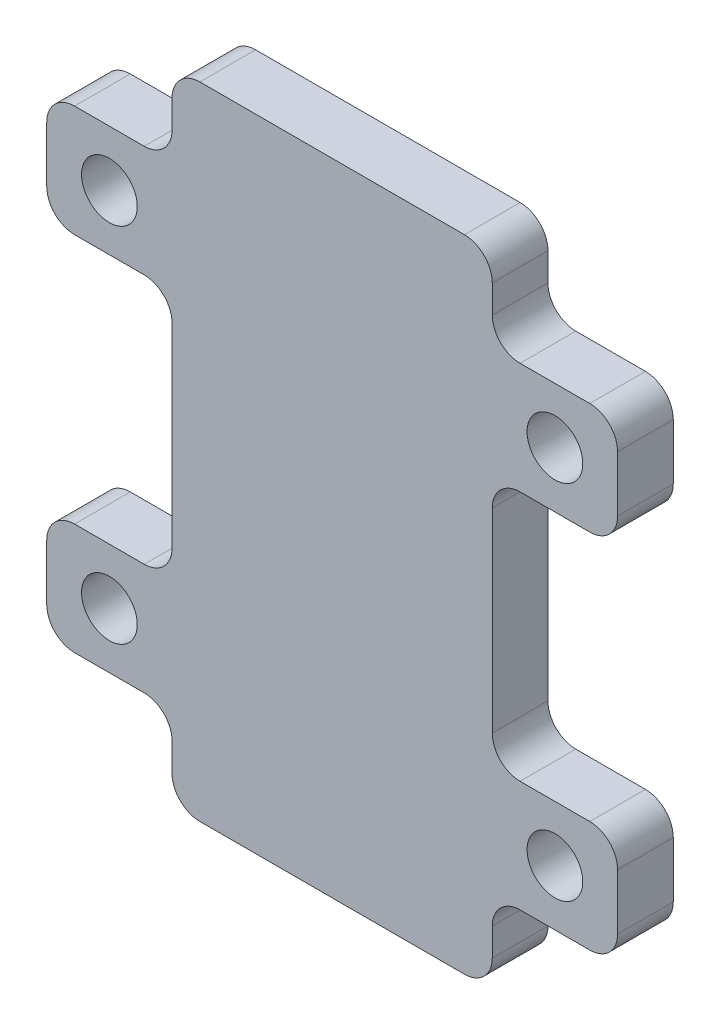
from build123d import *

# Parameters (mm, degrees)
SKETCH1_R           = 0.5
BOSS_EXTRUDE1_DEPTH = 1


with BuildPart() as part:
    # Sketch1 → Boss-Extrude1 (new body)
    with BuildSketch(Plane.XY):
        with BuildLine():
            Line((-2.875, 11), (-2.875, 10.5))
            ThreePointArc((-2.875, 10.5), (-3.021446609, 10.146446609), (-3.375, 10))
            Line((-3.375, 10), (-4.625, 10))
            ThreePointArc((-4.625, 10), (-4.978553391, 9.853553391), (-5.125, 9.5))
            Line((-5.125, 9.5), (-5.125, 8.5))
            ThreePointArc((-5.125, 8.5), (-4.978553391, 8.146446609), (-4.625, 8))
            Line((-4.625, 8), (-3.375, 8))
            ThreePointArc((-3.375, 8), (-3.021446609, 7.853553391), (-2.875, 7.5))
            Line((-2.875, 7.5), (-2.875, 4))
            ThreePointArc((-2.875, 4), (-3.021446609, 3.646446609), (-3.375, 3.5))
            Line((-3.375, 3.5), (-4.625, 3.5))
            ThreePointArc((-4.625, 3.5), (-4.978553391, 3.353553391), (-5.125, 3))
            Line((-5.125, 3), (-5.125, 2))
            ThreePointArc((-5.125, 2), (-4.978553391, 1.646446609), (-4.625, 1.5))
            Line((-4.625, 1.5), (-3.375, 1.5))
            ThreePointArc((-3.375, 1.5), (-3.021446609, 1.353553391), (-2.875, 1))
            Line((-2.875, 1), (-2.875, 0.5))
            ThreePointArc((-2.875, 0.5), (-2.728553391, 0.146446609), (-2.375, 0))
            Line((-2.375, 0), (2.375, 0))
            ThreePointArc((2.375, 0), (2.728553391, 0.146446609), (2.875, 0.5))
            Line((2.875, 0.5), (2.875, 1))
            ThreePointArc((2.875, 1), (3.021446609, 1.353553391), (3.375, 1.5))
            Line((3.375, 1.5), (4.625, 1.5))
            ThreePointArc((4.625, 1.5), (4.978553391, 1.646446609), (5.125, 2))
            Line((5.125, 2), (5.125, 3))
            ThreePointArc((5.125, 3), (4.978553391, 3.353553391), (4.625, 3.5))
            Line((4.625, 3.5), (3.375, 3.5))
            ThreePointArc((3.375, 3.5), (3.021446609, 3.646446609), (2.875, 4))
            Line((2.875, 4), (2.875, 7.5))
            ThreePointArc((2.875, 7.5), (3.021446609, 7.853553391), (3.375, 8))
            Line((3.375, 8), (4.625, 8))
            ThreePointArc((4.625, 8), (4.978553391, 8.146446609), (5.125, 8.5))
            Line((5.125, 8.5), (5.125, 9.5))
            ThreePointArc((5.125, 9.5), (4.978553391, 9.853553391), (4.625, 10))
            Line((4.625, 10), (3.375, 10))
            ThreePointArc((3.375, 10), (3.021446609, 10.146446609), (2.875, 10.5))
            Line((2.875, 10.5), (2.875, 11))
            ThreePointArc((2.875, 11), (2.728553391, 11.353553391), (2.375, 11.5))
            Line((2.375, 11.5), (-2.375, 11.5))
            ThreePointArc((-2.375, 11.5), (-2.728553391, 11.353553391), (-2.875, 11))
        make_face()
        with Locations((-4, 9)):
            Circle(SKETCH1_R, mode=Mode.SUBTRACT)
        with Locations((-4, 2.5)):
            Circle(SKETCH1_R, mode=Mode.SUBTRACT)
        with Locations((4, 2.5)):
            Circle(SKETCH1_R, mode=Mode.SUBTRACT)
        with Locations((4, 9)):
            Circle(SKETCH1_R, mode=Mode.SUBTRACT)
    extrude(amount=BOSS_EXTRUDE1_DEPTH)


solid = part.part
